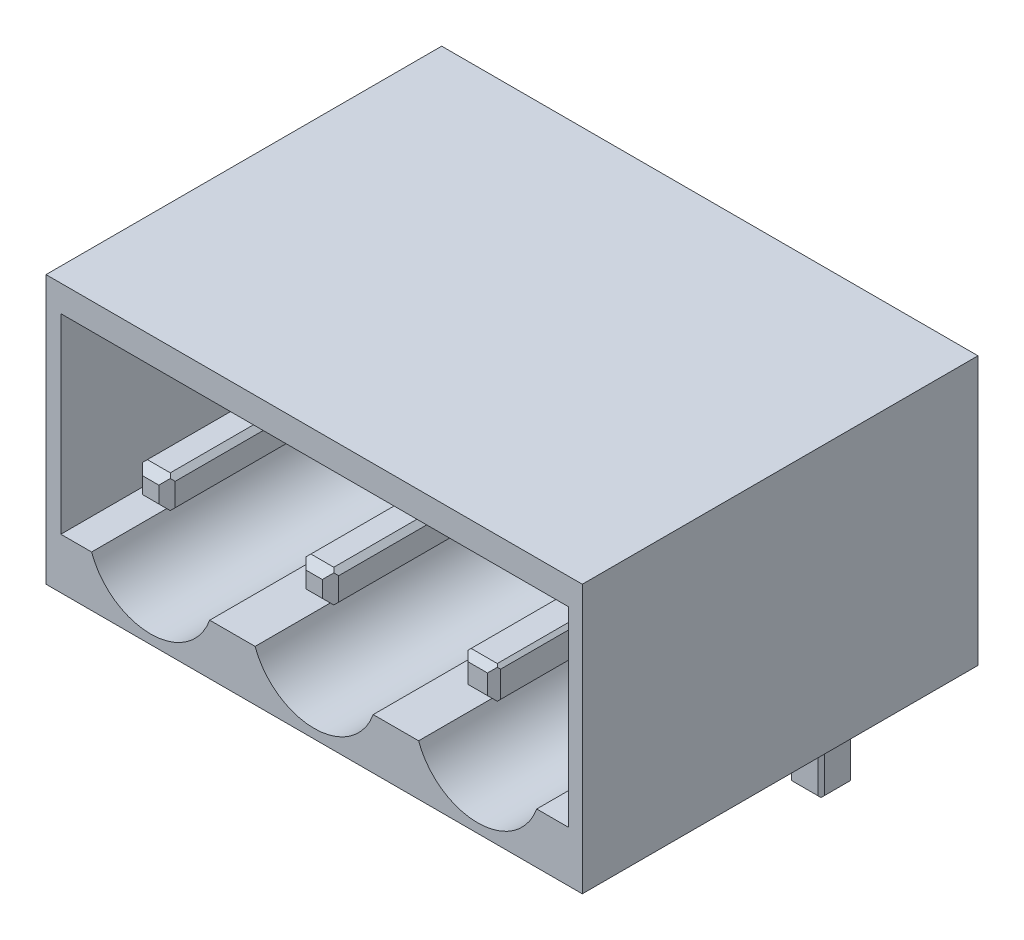
from build123d import *

# Parameters (mm, degrees)
SKETCH_1_W          = 16.4
SKETCH_1_H          = 8.2
EXTRUDE_1_DEPTH     = 12.1
SKETCH_4_R          = 1.25
CUT_EXTRUDE_3_DEPTH = 8
CUT_EXTRUDE_4_DEPTH = 7.8
SKETCH_7_W          = 1
SKETCH_7_H          = 1
EXTRUDE_2_DEPTH     = 8
CHAMFER_1_SIZE      = 0.15
CHAMFER_2_SIZE      = 0.25
SKETCH_8_W          = 1
SKETCH_8_H          = 1
EXTRUDE_3_DEPTH     = 4
CHAMFER_3_SIZE      = 0.15
CHAMFER_4_SIZE      = 0.25
CHAMFER_6_SIZE      = 0.1
CHAMFER_7_SIZE      = 0.2
CHAMFER_8_SIZE      = 0.1
CHAMFER_9_SIZE      = 0.2


with BuildPart() as part:
    # Эскиз1 → Бобышка-Вытянуть1 (new body)
    with BuildSketch(Plane.XY):
        Rectangle(SKETCH_1_W, SKETCH_1_H)
    extrude(amount=EXTRUDE_1_DEPTH)

    # Эскиз4 → Вырез-Вытянуть3 (cut)
    with BuildSketch(Plane.XY.offset(12.1)):
        with Locations((-5, 0)):
            Circle(SKETCH_4_R)
        Circle(SKETCH_4_R)
        with Locations((5, 0)):
            Circle(SKETCH_4_R)
    extrude(amount=-CUT_EXTRUDE_3_DEPTH, mode=Mode.SUBTRACT)

    # Эскиз5 → Вырез-Вытянуть4 (cut)
    with BuildSketch(Plane.XY.offset(12.1)):
        with BuildLine():
            Line((-7.745621634, 0), (-7.745621634, 3.292901982))
            Line((-7.745621634, 3.292901982), (2.778509544, 3.292901982))
            Line((2.778509544, 3.292901982), (7.778509544, 3.292901982))
            Line((7.778509544, 3.292901982), (7.778509544, -2.548957219))
            Line((7.778509544, -2.548957219), (6.80582632, -2.548957219))
            ThreePointArc((6.80582632, -2.548957219), (5, -3.818893996), (3.19417368, -2.548957219))
            Line((3.19417368, -2.548957219), (1.80582632, -2.548957219))
            ThreePointArc((1.80582632, -2.548957219), (0, -3.818893996), (-1.80582632, -2.548957219))
            Line((-1.80582632, -2.548957219), (-3.19417368, -2.548957219))
            ThreePointArc((-3.19417368, -2.548957219), (-5, -3.818893996), (-6.80582632, -2.548957219))
            Line((-6.80582632, -2.548957219), (-7.745621634, -2.548957219))
            Line((-7.745621634, -2.548957219), (-7.745621634, 0))
        make_face()
    extrude(amount=-CUT_EXTRUDE_4_DEPTH, mode=Mode.SUBTRACT)

    # Эскиз7 → Бобышка-Вытянуть2 (add)
    with BuildSketch(Plane.XY.offset(4.1)):
        Rectangle(SKETCH_7_W, SKETCH_7_H)
        with Locations((-5, 0)):
            Rectangle(SKETCH_7_W, SKETCH_7_H)
        with Locations((5, 0)):
            Rectangle(SKETCH_7_W, SKETCH_7_H)
    extrude(amount=EXTRUDE_2_DEPTH)

    # Фаска1
    chamfer_1_edges = [part.edges().sort_by_distance(p)[0] for p in [
        (-4.5, -0.5, 8.1),
        (-4.5, 0.5, 8.1),
        (-5.5, 0.5, 8.1),
        (-5.5, -0.5, 8.1),
        (0.5, -0.5, 8.1),
        (0.5, 0.5, 8.1),
        (-0.5, 0.5, 8.1),
        (-0.5, -0.5, 8.1),
    ]]
    chamfer(chamfer_1_edges, length=CHAMFER_1_SIZE)

    # Фаска2
    # the kernel refuses this chamfer: 0.25 mm, written as the material it takes off along each edge
    with BuildSketch(Plane(origin=(-0.5, -0.992920747, 12.1), x_dir=(-0.027495876610586414, 0, -0.9996219169112968), z_dir=(0, 1, 0)), Plane(origin=(-0.992920747, 0.5, 12.1), x_dir=(0, 0.027495876610586414, -0.9996219169112968), z_dir=(1, 0, 0)), Plane(origin=(0.5, 0.992920747, 12.1), x_dir=(0.027495876610586414, 0, -0.9996219169112968), z_dir=(0, -1, 0)), Plane(origin=(0.992920747, -0.5, 12.1), x_dir=(0, -0.027495876610586414, -0.9996219169112968), z_dir=(-1, 0, 0)), Plane(origin=(-4.5, 0.992920747, 12.1), x_dir=(0.02749587661058555, 0, -0.9996219169112968), z_dir=(0, -1, 0)), Plane(origin=(-4.007079253, -0.5, 12.1), x_dir=(0, -0.027495876610586414, -0.9996219169112968), z_dir=(-1, 0, 0)), Plane(origin=(-5.5, -0.992920747, 12.1), x_dir=(-0.02749587661058555, 0, -0.9996219169112968), z_dir=(0, 1, 0)), Plane(origin=(-5.992920747, 0.5, 12.1), x_dir=(0, 0.027495876610586414, -0.9996219169112968), z_dir=(1, 0, 0))) as chamfer_2_piece_1:
        Polygon((CHAMFER_2_SIZE * 0.999621916911, -CHAMFER_2_SIZE * 0.0274958766106), (-CHAMFER_2_SIZE * 0.0274958766106, -CHAMFER_2_SIZE * 0.999621916911), (0, 0), align=None)
    extrude(amount=1.985841494, mode=Mode.SUBTRACT)

    # Эскиз8 → Бобышка-Вытянуть3 (add)
    with BuildSketch(Plane(origin=(0, -4.1, 0), x_dir=(-1, 0, 0), z_dir=(0, -1, 0))):
        with Locations((0, -1.6)):
            Rectangle(SKETCH_8_W, SKETCH_8_H)
        with Locations((5, -1.6)):
            Rectangle(SKETCH_8_W, SKETCH_8_H)
        with Locations((-5, -1.6)):
            Rectangle(SKETCH_8_W, SKETCH_8_H)
    extrude(amount=EXTRUDE_3_DEPTH)

    # Фаска3
    chamfer_3_edges = [part.edges().sort_by_distance(p)[0] for p in [
        (-4.5, -6.1, 1.1),
        (-4.5, -6.1, 2.1),
        (-5.5, -6.1, 2.1),
        (-5.5, -6.1, 1.1),
        (0.5, -6.1, 1.1),
        (0.5, -6.1, 2.1),
        (-0.5, -6.1, 2.1),
        (-0.5, -6.1, 1.1),
    ]]
    chamfer(chamfer_3_edges, length=CHAMFER_3_SIZE)

    # Фаска4
    # the kernel refuses this chamfer: 0.25 mm, written as the material it takes off along each edge
    with BuildSketch(Plane(origin=(0.5, -8.1, 2.592920747), x_dir=(0.02749587661058651, 0.9996219169112968, 0), z_dir=(0, 0, -1)), Plane(origin=(-0.5, -8.1, 0.607079253), x_dir=(-0.02749587661058651, 0.9996219169112968, 0), z_dir=(0, 0, 1)), Plane(origin=(-0.992920747, -8.1, 2.1), x_dir=(0, 0.9996219169112968, 0.027495876610585647), z_dir=(1, 0, 0)), Plane(origin=(0.992920747, -8.1, 1.1), x_dir=(0, 0.9996219169112968, -0.02749587661058651), z_dir=(-1, 0, 0)), Plane(origin=(-5.5, -8.1, 0.607079253), x_dir=(-0.027495876610585647, 0.9996219169112968, 0), z_dir=(0, 0, 1)), Plane(origin=(-5.992920747, -8.1, 2.1), x_dir=(0, 0.9996219169112968, 0.027495876610585647), z_dir=(1, 0, 0)), Plane(origin=(-4.5, -8.1, 2.592920747), x_dir=(0.027495876610585647, 0.9996219169112968, 0), z_dir=(0, 0, -1)), Plane(origin=(-4.007079253, -8.1, 1.1), x_dir=(0, 0.9996219169112968, -0.02749587661058651), z_dir=(-1, 0, 0))) as chamfer_4_piece_1:
        Polygon((CHAMFER_4_SIZE * 0.999621916911, -CHAMFER_4_SIZE * 0.0274958766106), (-CHAMFER_4_SIZE * 0.0274958766106, -CHAMFER_4_SIZE * 0.999621916911), (0, 0), align=None)
    extrude(amount=1.985841494, mode=Mode.SUBTRACT)

    # Фаска6
    chamfer_6_edges = [part.edges().sort_by_distance(p)[0] for p in [
        (5.5, -0.5, 8.1),
        (5.5, 0.5, 8.1),
        (4.5, 0.5, 8.1),
        (4.5, -0.5, 8.1),
    ]]
    chamfer(chamfer_6_edges, length=CHAMFER_6_SIZE)

    # Фаска7
    # the kernel refuses this chamfer: 0.2 mm, written as the material it takes off along each edge
    with BuildSketch(Plane(origin=(5.5, 0.914336598, 12.1), x_dir=(0.02749587661058742, 0, -0.9996219169112966), z_dir=(0, -1, 0)), Plane(origin=(5.914336598, -0.5, 12.1), x_dir=(0, -0.02749587661058634, -0.9996219169112966), z_dir=(-1, 0, 0)), Plane(origin=(4.5, -0.914336598, 12.1), x_dir=(-0.02749587661058742, 0, -0.9996219169112966), z_dir=(0, 1, 0)), Plane(origin=(4.085663402, 0.5, 12.1), x_dir=(0, 0.02749587661058634, -0.9996219169112966), z_dir=(1, 0, 0))) as chamfer_7_piece_1:
        Polygon((CHAMFER_7_SIZE * 0.999621916911, -CHAMFER_7_SIZE * 0.0274958766106), (-CHAMFER_7_SIZE * 0.0274958766106, -CHAMFER_7_SIZE * 0.999621916911), (0, 0), align=None)
    extrude(amount=1.828673195, mode=Mode.SUBTRACT)

    # Фаска8
    chamfer_8_edges = [part.edges().sort_by_distance(p)[0] for p in [
        (5.5, -6.1, 1.1),
        (5.5, -6.1, 2.1),
        (4.5, -6.1, 2.1),
        (4.5, -6.1, 1.1),
    ]]
    chamfer(chamfer_8_edges, length=CHAMFER_8_SIZE)

    # Фаска9
    # the kernel refuses this chamfer: 0.2 mm, written as the material it takes off along each edge
    with BuildSketch(Plane(origin=(5.5, -8.1, 2.514336598), x_dir=(0.027495876610587302, 0.9996219169112966, 0), z_dir=(0, 0, -1)), Plane(origin=(5.914336598, -8.1, 1.1), x_dir=(0, 0.9996219169112968, -0.027495876610586226), z_dir=(-1, 0, 0)), Plane(origin=(4.5, -8.1, 0.685663402), x_dir=(-0.027495876610587302, 0.9996219169112966, 0), z_dir=(0, 0, 1)), Plane(origin=(4.085663402, -8.1, 2.1), x_dir=(0, 0.9996219169112966, 0.027495876610587302), z_dir=(1, 0, 0))) as chamfer_9_piece_1:
        Polygon((CHAMFER_9_SIZE * 0.999621916911, -CHAMFER_9_SIZE * 0.0274958766106), (-CHAMFER_9_SIZE * 0.0274958766106, -CHAMFER_9_SIZE * 0.999621916911), (0, 0), align=None)
    extrude(amount=1.828673195, mode=Mode.SUBTRACT)


solid = part.part
